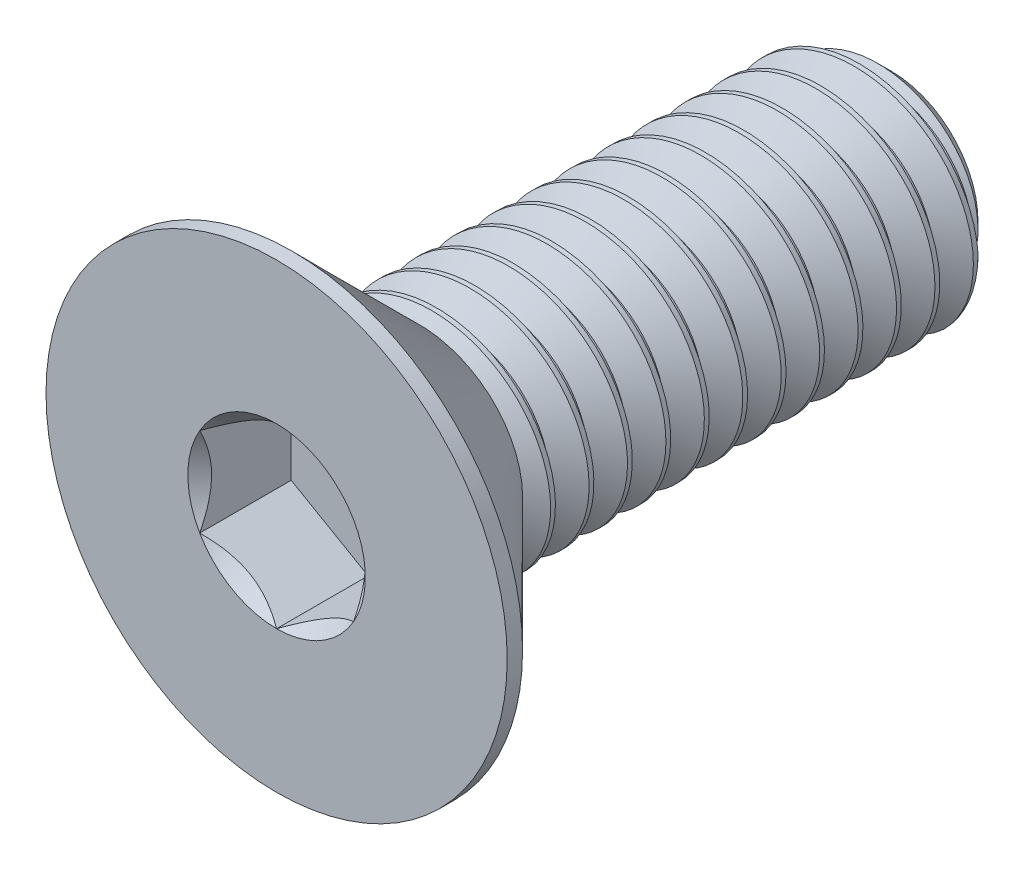
from build123d import *
from build123d.topology import SkipClean

# Parameters (mm, degrees)
SKETCH1_W          = 8
SKETCH1_H          = 1.5
CHAMFER1_SIZE      = 0.375
CUT_SWEEP1_PITCH   = 0.5
CUT_EXTRUDE2_DEPTH = 1.19


with BuildPart() as part:
    # Sketch1 → Revolve1 (revolve)
    with BuildSketch(Plane(origin=(0, 0, 0), x_dir=(0, 0, -1), z_dir=(1, 0, 0))):
        with Locations((4, 0.75)):
            Rectangle(SKETCH1_W, SKETCH1_H)
    revolve(axis=Axis((0, 0, -8), (0, 0, 1)))

    # Chamfer1
    chamfer1_edges = [part.edges().sort_by_distance(p)[0] for p in [
        (0, -1.5, -8),
    ]]
    chamfer(chamfer1_edges, length=CHAMFER1_SIZE)

    # Cut-Sweep1: arcs per turn and ends read off the stored shape
    # Cut-Sweep1: the profile of Sketch2 profile screwed along a right-hand helix through 17 turns, 6 arcs to a turn; built about Z, then put on its axis
    cut_sweep1_z = Axis((0, 0, 0), (0, 0, 1))
    cut_sweep1_corners = [(1.5003, 0, 0.000173205), (1.5003, 0, -0.437673205), (1.175240474, 0, -0.25), (1.175240474, 0, -0.1875)]
    with BuildLine(mode=Mode.PRIVATE) as cut_sweep1_profile:
        Line(cut_sweep1_corners[0], cut_sweep1_corners[1])
        Line(cut_sweep1_corners[1], cut_sweep1_corners[2])
        Line(cut_sweep1_corners[2], cut_sweep1_corners[3])
        Line(cut_sweep1_corners[3], cut_sweep1_corners[0])
    cut_sweep1_cap = Face(cut_sweep1_profile.wire())
    cut_sweep1_turn_angles = [0, 30, 60, 90, 120, 150, 180, 210, 240, 270, 300, 330, 360]
    cut_sweep1_turn_weights = [1, 0.8660254037844387, 1, 0.8660254037844387, 1, 0.8660254037844387, 1, 0.8660254037844387, 1, 0.8660254037844387, 1, 0.8660254037844387, 1]
    cut_sweep1_turn_rails = [Edge.make_bspline([Vector(p[0], p[1], 0).rotate(cut_sweep1_z, cut_sweep1_turn_angles[k]) / cut_sweep1_turn_weights[k] + Vector(0, 0, p[2] + CUT_SWEEP1_PITCH * cut_sweep1_turn_angles[k] / 360) for k in range(13)], [0, 0, 0, 1, 1, 2, 2, 3, 3, 4, 4, 5, 5, 6, 6, 6], 2, cut_sweep1_turn_weights) for p in cut_sweep1_corners]
    cut_sweep1_turn_sides = [Face.make_surface_from_curves(cut_sweep1_turn_rails[p[0]], cut_sweep1_turn_rails[p[1]]) for p in [(0, 1), (1, 2), (2, 3), (3, 0)]]
    cut_sweep1_turn = Solid(Shell([*cut_sweep1_turn_sides, cut_sweep1_cap, cut_sweep1_cap.rotate(cut_sweep1_z, 360).moved(Location((0, 0, CUT_SWEEP1_PITCH * 360 / 360)))]))
    cut_sweep1_each = [*[cut_sweep1_turn.moved(Location((0, 0, CUT_SWEEP1_PITCH * i))) for i in range(17)]]
    add(Plane(origin=(0, 0, -8), x_dir=(0, 1, 0), z_dir=(0, 0, 1)) * Compound([cut_sweep1_each[i] for i in range(0, 17, 2)]), mode=Mode.SUBTRACT)
    add(Plane(origin=(0, 0, -8), x_dir=(0, 1, 0), z_dir=(0, 0, 1)) * Compound([cut_sweep1_each[i] for i in range(1, 17, 2)]), mode=Mode.SUBTRACT)

    # Sketch7 → Revolve2 (revolve)
    with BuildSketch(Plane(origin=(0, 0, 0), x_dir=(0, 0, -1), z_dir=(1, 0, 0)), mode=Mode.PRIVATE) as revolve2_sk:
        Polygon((0, 3), (0.2, 3), (1.7, 1.5), (1.7, 0), (0, 0), align=None)
    revolve(revolve2_sk.sketch.rotate(Axis((0, 0, 0), (0, 0, -1)), 180), axis=Axis((0, 0, 0), (0, 0, -1)))

    # Boss-Extrude1 cone 1 section (through the dimple's axis) → Boss-Extrude1 (revolve)
    with SkipClean():  # the faces are left unmerged after this step: merging them gives an invalid solid
        with BuildSketch(Plane(origin=(0, 0, -1.7), x_dir=(0, -1, 0), z_dir=(1, 0, 0))):
            Polygon((0, 0), (1.5, 0), (0, 1.5), align=None)
        revolve(axis=Axis((0, 0, -1.7), (0, 0, -1)))

    # Sketch5 → Cut-Extrude2 (cut)
    with SkipClean():  # the faces are left unmerged after this step: merging them gives an invalid solid
        with BuildSketch(Plane.XY):
            Polygon((1, -0.577350269), (1, 0.577350269), (0, 1.154700538), (-1, 0.577350269), (-1, -0.577350269), (0, -1.154700538), align=None)
        extrude(amount=-CUT_EXTRUDE2_DEPTH, mode=Mode.SUBTRACT)

    # Cut-Extrude3 cone 1 section (through the dimple's axis) → Cut-Extrude3 (revolve, cut)
    with SkipClean():  # the faces are left unmerged after this step: merging them gives an invalid solid
        with BuildSketch(Plane(origin=(0, 0, 0), x_dir=(0, -1, 0), z_dir=(1, 0, 0))):
            Polygon((0, 0), (1.154700538, 0), (0, 1.154700538), align=None)
        revolve(axis=Axis((0, 0, 0), (0, 0, -1)), mode=Mode.SUBTRACT)


solid = part.part
